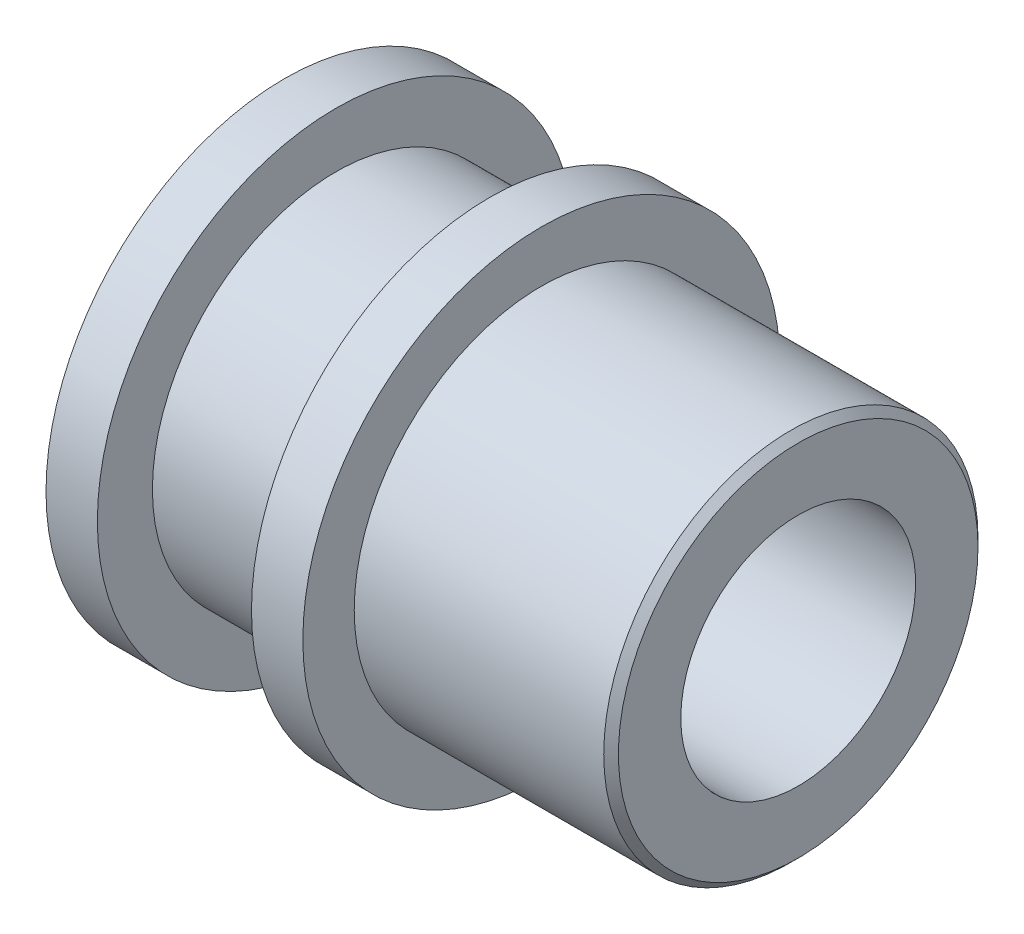
from build123d import *

# Parameters (mm, degrees)
SKETCH2_R          = 26.5
CUT_EXTRUDE1_DEPTH = 2
CHAMFER1_SIZE      = 2
SKETCH3_R          = 16
CUT_EXTRUDE2_DEPTH = 83.076184122
CHAMFER3_SIZE      = 1


with BuildPart() as part:
    # Sketch1 → Revolve1 (revolve)
    with BuildSketch(Plane(origin=(0, 0, 0), x_dir=(1, 0, 0), z_dir=(0, 1, 0))):
        Polygon((0, 0), (70, 0), (70, -25.5), (35, -25.5), (35, -32.5), (28, -32.5), (28, -25), (7, -25), (7, -32.5), (0, -32.5), align=None)
    revolve(axis=Axis((0, 0, 0), (1, 0, 0)))

    # Sketch2 → Cut-Extrude1 (cut)
    with BuildSketch(Plane.ZY):
        Circle(SKETCH2_R)
    extrude(amount=-CUT_EXTRUDE1_DEPTH, mode=Mode.SUBTRACT)

    # Chamfer1
    chamfer1_edges = [part.edges().sort_by_distance(p)[0] for p in [
        (2, 0, -26.5),
    ]]
    chamfer(chamfer1_edges, length=CHAMFER1_SIZE - 0.0001)  # a hair under: the kernel refuses the full size

    # Sketch3 → Cut-Extrude2 (cut, through all)
    with BuildSketch(Plane.ZY.offset(-2)):
        Circle(SKETCH3_R)
    extrude(amount=-CUT_EXTRUDE2_DEPTH, mode=Mode.SUBTRACT)

    # Chamfer3
    chamfer3_edges = [part.edges().sort_by_distance(p)[0] for p in [
        (70, 0, -25.5),
    ]]
    chamfer(chamfer3_edges, length=CHAMFER3_SIZE)


solid = part.part
